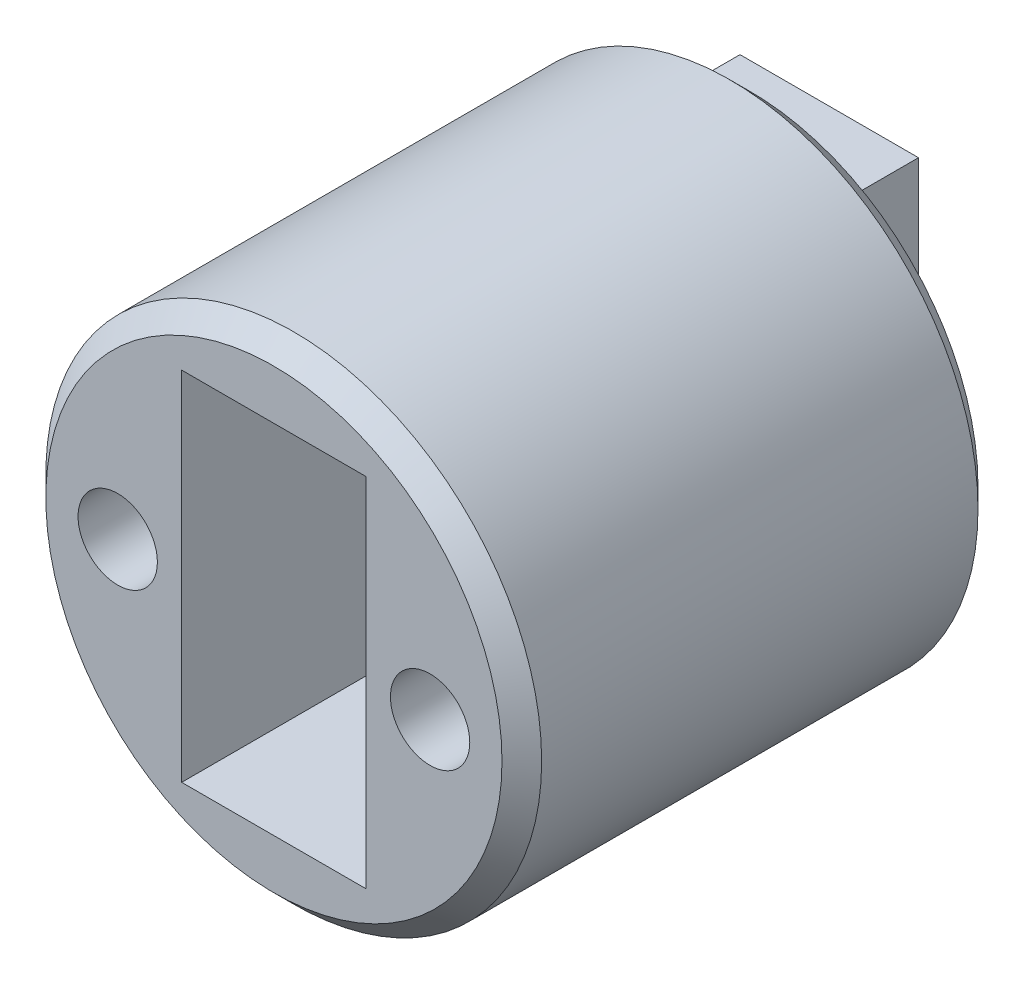
from build123d import *

# Parameters (mm, degrees)
CROQUIS1_R              = 12.5
SALIENTE_EXTRUIR1_DEPTH = 24
CROQUIS2_W              = 9.3
CROQUIS2_H              = 18
CORTAR_EXTRUIR1_DEPTH   = 18
CROQUIS3_W              = 9
CROQUIS3_H              = 17.7
SALIENTE_EXTRUIR2_DEPTH = 5
CHAFL_N1_SIZE           = 1
CHAFL_N2_SIZE           = 1
CROQUIS4_R              = 2
CORTAR_EXTRUIR2_DEPTH   = 34.963215395
CHAFL_N3_SIZE           = 1
CROQUIS5_W              = 6
CROQUIS5_H              = 14
CORTAR_EXTRUIR3_DEPTH   = 26.228951623
CHAFL_N4_SIZE           = 1.95


with BuildPart() as part:
    # Croquis1 → Saliente-Extruir1 (new body)
    with BuildSketch(Plane.XY):
        Circle(CROQUIS1_R)
    extrude(amount=SALIENTE_EXTRUIR1_DEPTH)

    # Croquis2 → Cortar-Extruir1 (cut)
    with BuildSketch(Plane.XY.offset(24)):
        Rectangle(CROQUIS2_W, CROQUIS2_H)
    extrude(amount=-CORTAR_EXTRUIR1_DEPTH, mode=Mode.SUBTRACT)

    # Croquis3 → Saliente-Extruir2 (add)
    with BuildSketch(Plane(origin=(0, 0, 0), x_dir=(-1, 0, 0), z_dir=(0, 0, -1))):
        Rectangle(CROQUIS3_W, CROQUIS3_H)
    extrude(amount=SALIENTE_EXTRUIR2_DEPTH)

    # Chaflán1
    chafl_n1_edges = [part.edges().sort_by_distance(p)[0] for p in [
        (-4.5, 0, -5),
        (0, 8.85, -5),
        (4.5, 0, -5),
        (0, -8.85, -5),
    ]]
    chamfer(chafl_n1_edges, length=CHAFL_N1_SIZE)

    # Chaflán2
    chafl_n2_edges = [part.edges().sort_by_distance(p)[0] for p in [
        (-12.5, 0, 0),
    ]]
    chamfer(chafl_n2_edges, length=CHAFL_N2_SIZE)

    # Croquis4 → Cortar-Extruir2 (cut, through all)
    with BuildSketch(Plane.XY.offset(24)):
        with Locations((-7.875, 0)):
            Circle(CROQUIS4_R)
        with Locations((7.875, 0)):
            Circle(CROQUIS4_R)
    extrude(amount=-CORTAR_EXTRUIR2_DEPTH, mode=Mode.SUBTRACT)

    # Chaflán3
    chafl_n3_edges = [part.edges().sort_by_distance(p)[0] for p in [
        (-12.5, 0, 24),
    ]]
    chamfer(chafl_n3_edges, length=CHAFL_N3_SIZE)

    # Croquis5 → Cortar-Extruir3 (cut, through all)
    with BuildSketch(Plane.XY.offset(6)):
        Rectangle(CROQUIS5_W, CROQUIS5_H)
    extrude(amount=-CORTAR_EXTRUIR3_DEPTH, mode=Mode.SUBTRACT)

    # Chaflán4
    # the kernel refuses this chamfer: 1.95 mm, written as the material it adds along each edge
    with BuildSketch(Plane(origin=(4.65, 9, 6), x_dir=(0.02749587661058626, 0, 0.9996219169112968), z_dir=(0, -1, 0))) as chafl_n4_piece_1_section:
        Polygon((CHAFL_N4_SIZE * 0.999621916911, CHAFL_N4_SIZE * 0.0274958766106), (-CHAFL_N4_SIZE * 0.0274958766106, CHAFL_N4_SIZE * 0.999621916911), (0, 0), align=None)
    chafl_n4_piece_1 = extrude(amount=18, mode=Mode.PRIVATE)
    chafl_n4_piece_1 = split(chafl_n4_piece_1, bisect_by=Plane(origin=(3, 8, 6.663333333), z_dir=(1, 0, 0)), keep=Keep.TOP, mode=Mode.PRIVATE)
    add(chafl_n4_piece_1)
    with BuildSketch(Plane(origin=(4.65, 9, 6), x_dir=(0.02749587661058626, 0, 0.9996219169112968), z_dir=(0, -1, 0))) as chafl_n4_piece_2_section:
        Polygon((CHAFL_N4_SIZE * 0.999621916911, CHAFL_N4_SIZE * 0.0274958766106), (-CHAFL_N4_SIZE * 0.0274958766106, CHAFL_N4_SIZE * 0.999621916911), (0, 0), align=None)
    chafl_n4_piece_2 = extrude(amount=23.014781827, mode=Mode.PRIVATE)
    chafl_n4_piece_2 = split(chafl_n4_piece_2, bisect_by=Plane(origin=(2.9, 7, 6.1), z_dir=(0, 1, 0)), keep=Keep.TOP, mode=Mode.PRIVATE)
    add(chafl_n4_piece_2)
    with BuildSketch(Plane(origin=(4.65, 14.014781827, 6), x_dir=(0.02749587661058626, 0, 0.9996219169112968), z_dir=(0, -1, 0))) as chafl_n4_piece_3_section:
        Polygon((CHAFL_N4_SIZE * 0.999621916911, CHAFL_N4_SIZE * 0.0274958766106), (-CHAFL_N4_SIZE * 0.0274958766106, CHAFL_N4_SIZE * 0.999621916911), (0, 0), align=None)
    chafl_n4_piece_3 = extrude(amount=23.014781827, mode=Mode.PRIVATE)
    chafl_n4_piece_3 = split(chafl_n4_piece_3, bisect_by=Plane(origin=(2.9, -7, 6.1), z_dir=(0, -1, 0)), keep=Keep.TOP, mode=Mode.PRIVATE)
    add(chafl_n4_piece_3)
    with BuildSketch(Plane(origin=(-4.65, 9, 6), x_dir=(0, 0.02749587661058626, 0.9996219169112968), z_dir=(1, 0, 0)), Plane(origin=(4.65, -9, 6), x_dir=(0, -0.02749587661058626, 0.9996219169112968), z_dir=(-1, 0, 0))) as chafl_n4_piece_4:
        Polygon((CHAFL_N4_SIZE * 0.999621916911, CHAFL_N4_SIZE * 0.0274958766106), (-CHAFL_N4_SIZE * 0.0274958766106, CHAFL_N4_SIZE * 0.999621916911), (0, 0), align=None)
    extrude(amount=9.3)
    with BuildSketch(Plane(origin=(-4.65, -9, 6), x_dir=(-0.02749587661058626, 0, 0.9996219169112968), z_dir=(0, 1, 0))) as chafl_n4_piece_5_section:
        Polygon((CHAFL_N4_SIZE * 0.999621916911, CHAFL_N4_SIZE * 0.0274958766106), (-CHAFL_N4_SIZE * 0.0274958766106, CHAFL_N4_SIZE * 0.999621916911), (0, 0), align=None)
    chafl_n4_piece_5 = extrude(amount=18, mode=Mode.PRIVATE)
    chafl_n4_piece_5 = split(chafl_n4_piece_5, bisect_by=Plane(origin=(-3, -8, 6.663333333), z_dir=(-1, 0, 0)), keep=Keep.TOP, mode=Mode.PRIVATE)
    add(chafl_n4_piece_5)
    with BuildSketch(Plane(origin=(-4.65, -9, 6), x_dir=(-0.02749587661058626, 0, 0.9996219169112968), z_dir=(0, 1, 0))) as chafl_n4_piece_6_section:
        Polygon((CHAFL_N4_SIZE * 0.999621916911, CHAFL_N4_SIZE * 0.0274958766106), (-CHAFL_N4_SIZE * 0.0274958766106, CHAFL_N4_SIZE * 0.999621916911), (0, 0), align=None)
    chafl_n4_piece_6 = extrude(amount=23.014781827, mode=Mode.PRIVATE)
    chafl_n4_piece_6 = split(chafl_n4_piece_6, bisect_by=Plane(origin=(-2.9, -7, 6.1), z_dir=(0, -1, 0)), keep=Keep.TOP, mode=Mode.PRIVATE)
    add(chafl_n4_piece_6)
    with BuildSketch(Plane(origin=(-4.65, -14.014781827, 6), x_dir=(-0.02749587661058626, 0, 0.9996219169112968), z_dir=(0, 1, 0))) as chafl_n4_piece_7_section:
        Polygon((CHAFL_N4_SIZE * 0.999621916911, CHAFL_N4_SIZE * 0.0274958766106), (-CHAFL_N4_SIZE * 0.0274958766106, CHAFL_N4_SIZE * 0.999621916911), (0, 0), align=None)
    chafl_n4_piece_7 = extrude(amount=23.014781827, mode=Mode.PRIVATE)
    chafl_n4_piece_7 = split(chafl_n4_piece_7, bisect_by=Plane(origin=(-2.9, 7, 6.1), z_dir=(0, 1, 0)), keep=Keep.TOP, mode=Mode.PRIVATE)
    add(chafl_n4_piece_7)


solid = part.part
